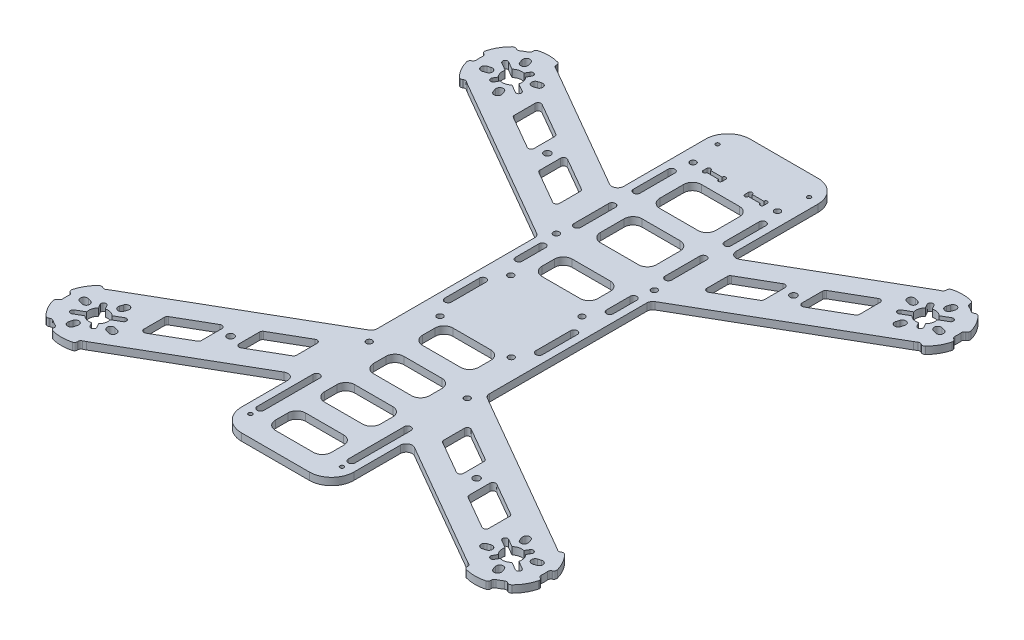
from build123d import *

# Parameters (mm, degrees)
SKETCH1_R                     = 1.27
MAIN_BODY_DEPTH               = 3.1242
SKETCH2_R                     = 0.79375
SKETCH2_W                     = 8.128
SKETCH2_H                     = 1.5875
CAMERA_PLATE_SLOTS_DEPTH      = 204.165728541
LONG_SLOT_CUTOUT_DEPTH        = 204.165728541
RECTANGLE_CUTOUT_DEPTH        = 204.165728541
LPATTERN1_COUNT               = 2
LPATTERN1_PITCH               = 25.4
LPATTERN1_COPY_1_DEPTH        = 204.165728541
LPATTERN2_COUNT               = 2
LPATTERN2_PITCH               = 80.645
LPATTERN2_COPY_1_DEPTH        = 204.165728541
CUT_EXTRUDE5_DEPTH            = 204.165728541
CUT_EXTRUDE6_DEPTH            = 204.165728541
SKETCH10_R                    = 1.27
CC3D_1ST_PAIR_HOLES_CUT_DEPTH = 204.165728541
LPATTERN11_COUNT              = 2
LPATTERN11_PITCH              = 51.0286
LPATTERN13_COPY_1_DEPTH       = 204.165728541
LPATTERN13_COPY_2_DEPTH       = 204.165728541
LPATTERN13_COPY_3_DEPTH       = 204.165728541
CUT_EXTRUDE8_DEPTH            = 204.165728541
SKETCH12_R                    = 0.8255
CUT_EXTRUDE9_DEPTH            = 204.165728541
MOTOR_ARM_DEPTH               = 3.1242
BOSS_EXTRUDE2_DEPTH           = 3.1242
CIRPATTERN1_COUNT             = 6
CUT_EXTRUDE10_DEPTH           = 227.94644188
CIRPATTERN2_COUNT             = 4
FILLET1_R                     = 1.27
SKETCH16_R                    = 1.4605
CUT_EXTRUDE11_DEPTH           = 227.86409447
FILLET2_R                     = 1.27
FILLET3_R                     = 2.54


with BuildPart() as part:
    # Sketch1 → MAIN BODY (new body)
    with BuildSketch(Plane(origin=(0, 0, 0), x_dir=(1, 0, 0), z_dir=(0, 1, 0))):
        with BuildLine():
            Line((-14.5161, 15.7734), (14.5161, 15.7734))
            ThreePointArc((14.5161, 15.7734), (21.251292091, 12.983592091), (24.0411, 6.2484))
            Line((24.0411, 6.2484), (24.0411, -192.1891))
            ThreePointArc((24.0411, -192.1891), (21.251292091, -198.924292091), (14.5161, -201.7141))
            Line((14.5161, -201.7141), (-14.5161, -201.7141))
            ThreePointArc((-14.5161, -201.7141), (-21.251292091, -198.924292091), (-24.0411, -192.1891))
            Line((-24.0411, -192.1891), (-24.0411, 6.2484))
            ThreePointArc((-24.0411, 6.2484), (-21.251292091, 12.983592091), (-14.5161, 15.7734))
        make_face()
        with Locations(Location((-20.955, -60.6425, 0), (0, 0, 270))):
            Circle(SKETCH1_R, mode=Mode.SUBTRACT)
        with Locations(Location((20.955, -60.6425, 0), (0, 0, 270))):
            Circle(SKETCH1_R, mode=Mode.SUBTRACT)
        with Locations(Location((-18.034, -5.08, 0), (0, 0, 270))):
            Circle(SKETCH1_R, mode=Mode.SUBTRACT)
        with Locations(Location((18.034, -5.08, 0), (0, 0, 270))):
            Circle(SKETCH1_R, mode=Mode.SUBTRACT)
        with Locations(Location((-20.955, -140.6398, 0), (0, 0, 270))):
            Circle(SKETCH1_R, mode=Mode.SUBTRACT)
        with Locations(Location((20.955, -140.6398, 0), (0, 0, 270))):
            Circle(SKETCH1_R, mode=Mode.SUBTRACT)
    extrude(amount=MAIN_BODY_DEPTH)

    # Sketch2 → CAMERA PLATE SLOTS (cut, through all)
    with BuildSketch(Plane(origin=(0, 3.1242, 0), x_dir=(1, 0, 0), z_dir=(0, 1, 0))):
        with Locations((5.61975, -5.87375)):
            Circle(SKETCH2_R)
        with Locations((5.61975, -4.28625)):
            Circle(SKETCH2_R)
        with Locations((12.16025, -4.28625)):
            Circle(SKETCH2_R)
        with Locations((12.16025, -5.87375)):
            Circle(SKETCH2_R)
        with Locations((8.89, -5.08)):
            Rectangle(SKETCH2_W, SKETCH2_H)
    camera_plate_slots = extrude(amount=-CAMERA_PLATE_SLOTS_DEPTH, mode=Mode.SUBTRACT)

    # Mirror2: CAMERA PLATE SLOTS across plane
    add(camera_plate_slots.mirror(Plane(origin=(0, 0, 0), x_dir=(0, 0, 1), z_dir=(1, 0, 0))), mode=Mode.SUBTRACT)

    # Sketch4 → LONG SLOT CUTOUT (cut, through all)
    with BuildSketch(Plane(origin=(0, 3.1242, 0), x_dir=(1, 0, 0), z_dir=(0, 1, 0))):
        with BuildLine():
            Line((20.9169, -12.8778), (20.9169, -27.7622))
            ThreePointArc((20.9169, -27.7622), (19.4691, -29.21), (18.0213, -27.7622))
            Line((18.0213, -27.7622), (18.0213, -12.8778))
            ThreePointArc((18.0213, -12.8778), (19.4691, -11.43), (20.9169, -12.8778))
        make_face()
    long_slot_cutout = extrude(amount=-LONG_SLOT_CUTOUT_DEPTH, mode=Mode.SUBTRACT)

    # Mirror1: LONG SLOT CUTOUT across plane
    add(long_slot_cutout.mirror(Plane(origin=(0, 0, 0), x_dir=(0, 0, 1), z_dir=(1, 0, 0))), mode=Mode.SUBTRACT)

    # Sketch3 → RECTANGLE CUTOUT (cut, through all)
    with BuildSketch(Plane(origin=(0, 3.1242, 0), x_dir=(1, 0, 0), z_dir=(0, 1, 0))):
        with BuildLine():
            Line((-8.1407, -29.21), (8.1407, -29.21))
            ThreePointArc((8.1407, -29.21), (10.834776836, -28.094076836), (11.9507, -25.4))
            Line((11.9507, -25.4), (11.9507, -15.24))
            ThreePointArc((11.9507, -15.24), (10.834776836, -12.545923164), (8.1407, -11.43))
            Line((8.1407, -11.43), (-8.1407, -11.43))
            ThreePointArc((-8.1407, -11.43), (-10.834776836, -12.545923164), (-11.9507, -15.24))
            Line((-11.9507, -15.24), (-11.9507, -25.4))
            ThreePointArc((-11.9507, -25.4), (-10.834776836, -28.094076836), (-8.1407, -29.21))
        make_face()
    rectangle_cutout = extrude(amount=-RECTANGLE_CUTOUT_DEPTH, mode=Mode.SUBTRACT)

    # LPattern1: LONG SLOT CUTOUT, RECTANGLE CUTOUT ×2
    with Locations(*[(0, 0, i * LPATTERN1_PITCH) for i in range(1, LPATTERN1_COUNT)]):
        add(long_slot_cutout, mode=Mode.SUBTRACT)
        add(rectangle_cutout, mode=Mode.SUBTRACT)

    # LPattern1 copy 1 sketch → LPattern1 copy 1 (cut, through all)
    with BuildSketch(Plane(origin=(0, 3.1242, 25.4), x_dir=(-1, 0, 0), z_dir=(0, 1, 0))):
        with BuildLine():
            Line((20.9169, 12.8778), (20.9169, 27.7622))
            ThreePointArc((20.9169, 27.7622), (19.4691, 29.21), (18.0213, 27.7622))
            Line((18.0213, 27.7622), (18.0213, 12.8778))
            ThreePointArc((18.0213, 12.8778), (19.4691, 11.43), (20.9169, 12.8778))
        make_face()
    extrude(amount=-LPATTERN1_COPY_1_DEPTH, mode=Mode.SUBTRACT)

    # LPattern2: LONG SLOT CUTOUT ×2
    with Locations(*[(0, 0, i * LPATTERN2_PITCH) for i in range(1, LPATTERN2_COUNT)]):
        add(long_slot_cutout, mode=Mode.SUBTRACT)

    # LPattern2 copy 1 sketch → LPattern2 copy 1 (cut, through all)
    with BuildSketch(Plane(origin=(0, 3.1242, 80.645), x_dir=(-1, 0, 0), z_dir=(0, 1, 0))):
        with BuildLine():
            Line((20.9169, 12.8778), (20.9169, 27.7622))
            ThreePointArc((20.9169, 27.7622), (19.4691, 29.21), (18.0213, 27.7622))
            Line((18.0213, 27.7622), (18.0213, 12.8778))
            ThreePointArc((18.0213, 12.8778), (19.4691, 11.43), (20.9169, 12.8778))
        make_face()
    extrude(amount=-LPATTERN2_COPY_1_DEPTH, mode=Mode.SUBTRACT)

    # Sketch7 → Cut-Extrude5 (cut, through all)
    with BuildSketch(Plane(origin=(0, 3.1242, 0), x_dir=(1, 0, 0), z_dir=(0, 1, 0))):
        with BuildLine():
            Line((-8.1407, -66.675), (8.1407, -66.675))
            ThreePointArc((8.1407, -66.675), (10.834776836, -67.790923164), (11.9507, -70.485))
            Line((11.9507, -70.485), (11.9507, -75.7936))
            ThreePointArc((11.9507, -75.7936), (10.834776836, -78.487676836), (8.1407, -79.6036))
            Line((8.1407, -79.6036), (-8.1407, -79.6036))
            ThreePointArc((-8.1407, -79.6036), (-10.834776836, -78.487676836), (-11.9507, -75.7936))
            Line((-11.9507, -75.7936), (-11.9507, -70.485))
            ThreePointArc((-11.9507, -70.485), (-10.834776836, -67.790923164), (-8.1407, -66.675))
        make_face()
    cut_extrude5 = extrude(amount=-CUT_EXTRUDE5_DEPTH, mode=Mode.SUBTRACT)

    # Sketch8 → Cut-Extrude6 (cut, through all)
    with BuildSketch(Plane(origin=(0, 3.1242, 0), x_dir=(1, 0, 0), z_dir=(0, 1, 0))):
        with BuildLine():
            Line((20.9169, -68.1228), (20.9169, -78.1558))
            ThreePointArc((20.9169, -78.1558), (19.4691, -79.6036), (18.0213, -78.1558))
            Line((18.0213, -78.1558), (18.0213, -68.1228))
            ThreePointArc((18.0213, -68.1228), (19.4691, -66.675), (20.9169, -68.1228))
        make_face()
    cut_extrude6 = extrude(amount=-CUT_EXTRUDE6_DEPTH, mode=Mode.SUBTRACT)

    # Mirror4: Cut-Extrude6 across plane
    add(cut_extrude6.mirror(Plane(origin=(0, 0, 0), x_dir=(0, 0, 1), z_dir=(1, 0, 0))), mode=Mode.SUBTRACT)

    # Sketch10 → CC3D 1ST PAIR HOLES CUT (cut, through all)
    with BuildSketch(Plane(origin=(0, 3.1242, 0), x_dir=(1, 0, 0), z_dir=(0, 1, 0))):
        with Locations(Location((15.24, -85.8393, 0), (0, 0, 270))):
            Circle(SKETCH10_R)
        with Locations(Location((-15.24, -85.8393, 0), (0, 0, 270))):
            Circle(SKETCH10_R)
    cc3d_1st_pair_holes_cut = extrude(amount=-CC3D_1ST_PAIR_HOLES_CUT_DEPTH, mode=Mode.SUBTRACT)

    # CC3D 2ND PAIR HOLES MIRROR: CC3D 1ST PAIR HOLES CUT across plane
    add(cc3d_1st_pair_holes_cut.mirror(Plane.XY.offset(100.965)), mode=Mode.SUBTRACT)

    # LPattern11: Cut-Extrude5 ×2
    with Locations(*[(0, 0, i * LPATTERN11_PITCH) for i in range(1, LPATTERN11_COUNT)]):
        add(cut_extrude5, mode=Mode.SUBTRACT)

    # LPattern13 copy 1 sketch → LPattern13 copy 1 (cut, through all)
    with BuildSketch(Plane(origin=(0, 3.1242, 72.009), x_dir=(1, 0, 0), z_dir=(0, 1, 0))):
        with BuildLine():
            Line((-8.1407, -66.675), (8.1407, -66.675))
            ThreePointArc((8.1407, -66.675), (10.834776836, -67.790923164), (11.9507, -70.485))
            Line((11.9507, -70.485), (11.9507, -75.7936))
            ThreePointArc((11.9507, -75.7936), (10.834776836, -78.487676836), (8.1407, -79.6036))
            Line((8.1407, -79.6036), (-8.1407, -79.6036))
            ThreePointArc((-8.1407, -79.6036), (-10.834776836, -78.487676836), (-11.9507, -75.7936))
            Line((-11.9507, -75.7936), (-11.9507, -70.485))
            ThreePointArc((-11.9507, -70.485), (-10.834776836, -67.790923164), (-8.1407, -66.675))
        make_face()
    extrude(amount=-LPATTERN13_COPY_1_DEPTH, mode=Mode.SUBTRACT)

    # LPattern13 copy 2 sketch → LPattern13 copy 2 (cut, through all)
    with BuildSketch(Plane(origin=(0, 3.1242, 92.9894), x_dir=(1, 0, 0), z_dir=(0, 1, 0))):
        with BuildLine():
            Line((-8.1407, -66.675), (8.1407, -66.675))
            ThreePointArc((8.1407, -66.675), (10.834776836, -67.790923164), (11.9507, -70.485))
            Line((11.9507, -70.485), (11.9507, -75.7936))
            ThreePointArc((11.9507, -75.7936), (10.834776836, -78.487676836), (8.1407, -79.6036))
            Line((8.1407, -79.6036), (-8.1407, -79.6036))
            ThreePointArc((-8.1407, -79.6036), (-10.834776836, -78.487676836), (-11.9507, -75.7936))
            Line((-11.9507, -75.7936), (-11.9507, -70.485))
            ThreePointArc((-11.9507, -70.485), (-10.834776836, -67.790923164), (-8.1407, -66.675))
        make_face()
    extrude(amount=-LPATTERN13_COPY_2_DEPTH, mode=Mode.SUBTRACT)

    # LPattern13 copy 3 sketch → LPattern13 copy 3 (cut, through all)
    with BuildSketch(Plane(origin=(0, 3.1242, 113.9698), x_dir=(1, 0, 0), z_dir=(0, 1, 0))):
        with BuildLine():
            Line((-8.1407, -66.675), (8.1407, -66.675))
            ThreePointArc((8.1407, -66.675), (10.834776836, -67.790923164), (11.9507, -70.485))
            Line((11.9507, -70.485), (11.9507, -75.7936))
            ThreePointArc((11.9507, -75.7936), (10.834776836, -78.487676836), (8.1407, -79.6036))
            Line((8.1407, -79.6036), (-8.1407, -79.6036))
            ThreePointArc((-8.1407, -79.6036), (-10.834776836, -78.487676836), (-11.9507, -75.7936))
            Line((-11.9507, -75.7936), (-11.9507, -70.485))
            ThreePointArc((-11.9507, -70.485), (-10.834776836, -67.790923164), (-8.1407, -66.675))
        make_face()
    extrude(amount=-LPATTERN13_COPY_3_DEPTH, mode=Mode.SUBTRACT)

    # Sketch11 → Cut-Extrude8 (cut, through all)
    with BuildSketch(Plane(origin=(0, 3.1242, 0), x_dir=(1, 0, 0), z_dir=(0, 1, 0))):
        with BuildLine():
            Line((20.9169, -164.6682), (20.9169, -188.5696))
            ThreePointArc((20.9169, -188.5696), (19.4691, -190.0174), (18.0213, -188.5696))
            Line((18.0213, -188.5696), (18.0213, -164.6682))
            ThreePointArc((18.0213, -164.6682), (19.4691, -163.2204), (20.9169, -164.6682))
        make_face()
    cut_extrude8 = extrude(amount=-CUT_EXTRUDE8_DEPTH, mode=Mode.SUBTRACT)

    # Mirror6: Cut-Extrude8 across plane
    add(cut_extrude8.mirror(Plane(origin=(0, 0, 0), x_dir=(0, 0, 1), z_dir=(1, 0, 0))), mode=Mode.SUBTRACT)

    # Sketch12 → Cut-Extrude9 (cut, through all)
    with BuildSketch(Plane(origin=(0, 3.1242, 0), x_dir=(1, 0, 0), z_dir=(0, 1, 0))):
        with Locations(Location((19.558, 6.8834, 0), (0, 0, 270))):
            Circle(SKETCH12_R)
        with Locations(Location((-19.558, 6.8834, 0), (0, 0, 270))):
            Circle(SKETCH12_R)
    cut_extrude9 = extrude(amount=-CUT_EXTRUDE9_DEPTH, mode=Mode.SUBTRACT)

    # Mirror7: Cut-Extrude9 across plane
    add(cut_extrude9.mirror(Plane.XY.offset(92.97035)), mode=Mode.SUBTRACT)


with BuildPart() as body_2:
    # Sketch13 → MOTOR ARM (new, through all)
    with BuildSketch(Plane(origin=(0, 3.1242, 0), x_dir=(1, 0, 0), z_dir=(0, 1, 0))):
        with BuildLine():
            Line((81.403347648, -0.068225109), (24.0411, -33.18633423))
            Line((24.0411, -33.18633423), (24.0411, -65.448667273))
            Line((24.0411, -65.448667273), (95.373347648, -24.264974891))
            ThreePointArc((95.373347648, -24.264974891), (100.486722539, -5.1816), (81.403347648, -0.068225109))
        make_face()
        with BuildLine():
            Line((80.974521006, -15.200475577), (84.398495911, -13.223642744))
            ThreePointArc((84.398495911, -13.223642744), (84.4014888, -11.098324391), (85.461556058, -9.256248262))
            Line((85.461556058, -9.256248262), (84.500723225, -7.592036978))
            ThreePointArc((84.500723225, -7.592036978), (84.895847648, -6.117412555), (86.370472072, -6.512536978))
            Line((86.370472072, -6.512536978), (87.331304905, -8.176748262))
            ThreePointArc((87.331304905, -8.176748262), (89.456623257, -8.179741152), (91.298699386, -9.23980841))
            Line((91.298699386, -9.23980841), (94.722674291, -7.262975577))
            ThreePointArc((94.722674291, -7.262975577), (96.197298714, -7.6581), (95.802174291, -9.132724423))
            Line((95.802174291, -9.132724423), (92.378199386, -11.109557256))
            ThreePointArc((92.378199386, -11.109557256), (92.375206496, -13.234875609), (91.315139239, -15.076951738))
            Line((91.315139239, -15.076951738), (92.275972072, -16.741163022))
            ThreePointArc((92.275972072, -16.741163022), (91.880847648, -18.215787445), (90.406223225, -17.820663022))
            Line((90.406223225, -17.820663022), (89.445390392, -16.156451738))
            ThreePointArc((89.445390392, -16.156451738), (87.32007204, -16.153458848), (85.477995911, -15.09339159))
            Line((85.477995911, -15.09339159), (82.054021006, -17.070224423))
            ThreePointArc((82.054021006, -17.070224423), (80.579396582, -16.6751), (80.974521006, -15.200475577))
        make_face(mode=Mode.SUBTRACT)
    extrude(amount=-MOTOR_ARM_DEPTH)

    # Sketch14 → Boss-Extrude2 (add, through all)
    with BuildSketch(Plane(origin=(0, 3.1242, 0), x_dir=(1, 0, 0), z_dir=(0, 1, 0))):
        with BuildLine():
            Line((98.873589249, -0.247064204), (97.118479635, -1.260377212))
            ThreePointArc((97.118479635, -1.260377212), (100.486722539, -5.1816), (102.198479635, -10.059195315))
            Line((102.198479635, -10.059195315), (103.953589249, -9.045882307))
            ThreePointArc((103.953589249, -9.045882307), (102.136500933, -4.2291), (98.873589249, -0.247064204))
        make_face()
    boss_extrude2 = extrude(amount=-BOSS_EXTRUDE2_DEPTH)

    # CirPattern1: Boss-Extrude2 ×6 about axis, 3 skipped
    cirpattern1_axis = Axis((88.388347648, 0, 12.1666), (0, 1, 0))
    add([boss_extrude2.rotate(cirpattern1_axis, i * 360 / CIRPATTERN1_COUNT) for i in range(1, CIRPATTERN1_COUNT) if i not in (2, 3, 4)])

    # Sketch15 → Cut-Extrude10 (cut, through all)
    with BuildSketch(Plane(origin=(0, 3.1242, 0), x_dir=(1, 0, 0), z_dir=(0, 1, 0))):
        with BuildLine():
            Line((92.598028471, -3.697004164), (92.185940971, -5.031842316))
            ThreePointArc((92.185940971, -5.031842316), (90.280203896, -6.038479392), (89.273566821, -4.132742317))
            Line((89.273566821, -4.132742317), (89.68565432, -2.797904165))
            ThreePointArc((89.68565432, -2.797904165), (91.591391395, -1.791267089), (92.598028471, -3.697004164))
        make_face()
    cut_extrude10 = extrude(amount=-CUT_EXTRUDE10_DEPTH, mode=Mode.SUBTRACT)

    # CirPattern2: Cut-Extrude10 ×4 about axis
    cirpattern2_axis = Axis((88.388347648, 0, 12.1666), (0, 1, 0))
    for i in range(1, CIRPATTERN2_COUNT):
        add(cut_extrude10.rotate(cirpattern2_axis, i * 360 / CIRPATTERN2_COUNT), mode=Mode.SUBTRACT)

    # Fillet1
    fillet1_edges = [body_2.edges().sort_by_distance(p)[0] for p in [
        (102.198479635, 1.5621, 10.059195315),
        (97.118479635, 1.5621, 1.260377212),
        (98.873589249, 1.5621, 0.247064204),
        (103.953589249, 1.5621, 9.045882307),
        (93.468347648, 1.5621, -0.847027473),
        (83.308347648, 1.5621, -0.847027473),
        (83.308347648, 1.5621, -2.873653489),
        (93.468347648, 1.5621, -2.873653489),
        (97.118479635, 1.5621, 23.072822788),
        (102.198479635, 1.5621, 14.274004685),
        (103.953589249, 1.5621, 15.287317693),
        (98.873589249, 1.5621, 24.086135796),
    ]]
    fillet(fillet1_edges, radius=FILLET1_R)

    # Sketch16 → Cut-Extrude11 (cut, through all)
    with BuildSketch(Plane(origin=(0, 3.1242, 0), x_dir=(1, 0, 0), z_dir=(0, 1, 0))):
        with Locations(Location((52.6034, -32.827049158, 0), (0, 0, 270))):
            Circle(SKETCH16_R)
        Polygon((31.4579, -39.16953054), (47.9679, -29.637477596), (47.9679, -41.369235065), (31.4579, -50.90128801), align=None)
        Polygon((57.2389, -24.28486325), (57.2389, -36.01662072), (73.7489, -26.484567776), (73.7489, -14.752810306), align=None)
    extrude(amount=-CUT_EXTRUDE11_DEPTH, mode=Mode.SUBTRACT)

    # Fillet2
    fillet2_edges = [body_2.edges().sort_by_distance(p)[0] for p in [
        (47.9679, 1.5621, 41.369235065),
        (31.4579, 1.5621, 50.90128801),
        (31.4579, 1.5621, 39.16953054),
        (47.9679, 1.5621, 29.637477596),
        (57.2389, 1.5621, 24.28486325),
        (73.7489, 1.5621, 14.752810306),
        (73.7489, 1.5621, 26.484567776),
        (57.2389, 1.5621, 36.01662072),
    ]]
    fillet(fillet2_edges, radius=FILLET2_R)


with BuildPart() as body_3:
    # Mirror24: mirrored copy
    add(body_2.part.mirror(Plane(origin=(0, 0, 0), x_dir=(0, 0, 1), z_dir=(1, 0, 0))))


with BuildPart() as body_4:
    # Mirror25: mirrored copy
    add(body_2.part.mirror(Plane.XY.offset(100.554947648)))


with BuildPart() as body_5:
    # Mirror25 2: mirrored copy
    add(body_3.part.mirror(Plane.XY.offset(100.554947648)))


with BuildPart() as body_2_1:
    add(body_2.part)

    # Combine1: union part, body 3, body 5, body 4
    add(part.part)
    add(body_3.part)
    add(body_5.part)
    add(body_4.part)

    # Fillet3
    fillet3_edges = [body_2_1.edges().sort_by_distance(p)[0] for p in [
        (24.0411, 1.5621, 65.448667273),
        (24.0411, 1.5621, 33.18633423),
        (24.0411, 1.5621, 167.923561066),
        (-24.0411, 1.5621, 33.18633423),
        (-24.0411, 1.5621, 135.661228024),
        (-24.0411, 1.5621, 65.448667273),
        (-24.0411, 1.5621, 167.923561066),
        (24.0411, 1.5621, 135.661228024),
    ]]
    fillet(fillet3_edges, radius=FILLET3_R)


solid = body_2_1.part
